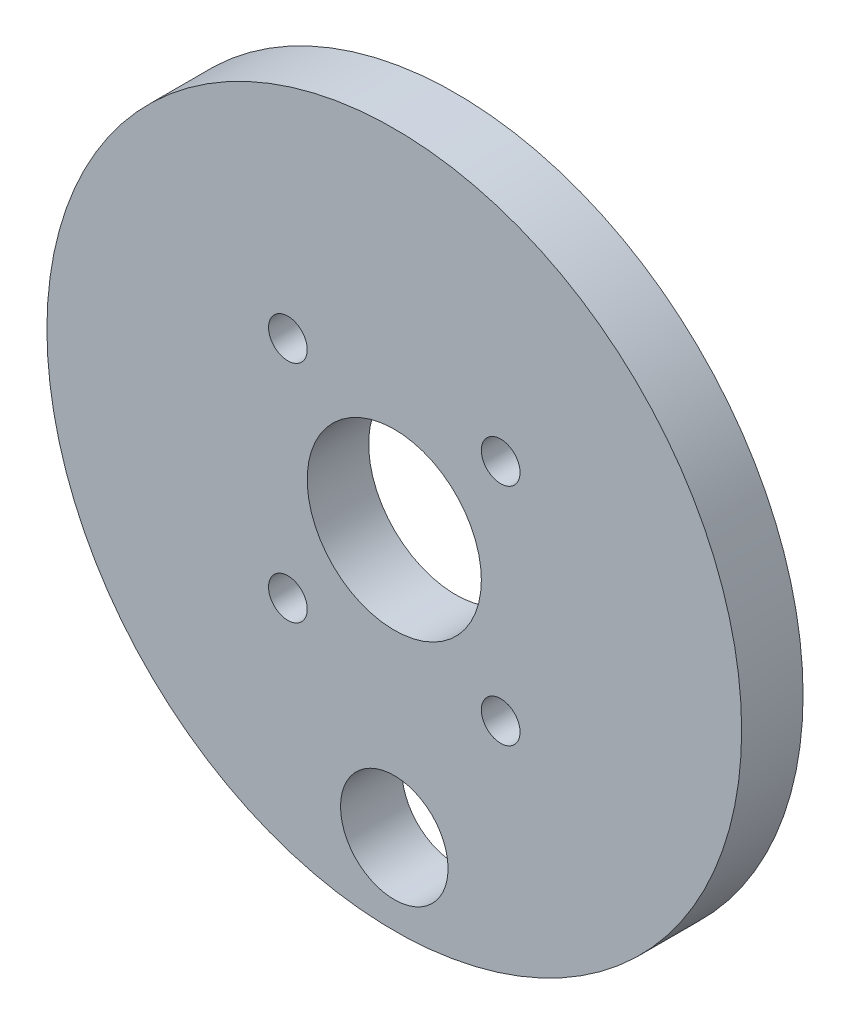
from build123d import *

# Parameters (mm, degrees)
SKETCH1_R           = 35.91
SKETCH1_R_2         = 9
BOSS_EXTRUDE1_DEPTH = 6.35
SKETCH2_R           = 2
CUT_EXTRUDE1_DEPTH  = 52.179866158
SKETCH3_R           = 5.55625
CUT_EXTRUDE2_DEPTH  = 52.179866158


with BuildPart() as part:
    # Sketch1 → Boss-Extrude1 (new body)
    with BuildSketch(Plane.XY):
        Circle(SKETCH1_R)
        Circle(SKETCH1_R_2, mode=Mode.SUBTRACT)
    extrude(amount=BOSS_EXTRUDE1_DEPTH)

    # Sketch2 → Cut-Extrude1 (cut, through all)
    with BuildSketch(Plane(origin=(0, 0, 0), x_dir=(-1, 0, 0), z_dir=(0, 0, -1))):
        with Locations((-11, 11.618950039)):
            Circle(SKETCH2_R)
        with Locations((11, 11.618950039)):
            Circle(SKETCH2_R)
        with Locations((11, -11.618950039)):
            Circle(SKETCH2_R)
        with Locations((-11, -11.618950039)):
            Circle(SKETCH2_R)
    extrude(amount=-CUT_EXTRUDE1_DEPTH, mode=Mode.SUBTRACT)

    # Sketch3 → Cut-Extrude2 (cut, through all)
    with BuildSketch(Plane(origin=(0, 0, 0), x_dir=(-1, 0, 0), z_dir=(0, 0, -1))):
        with Locations((0, -27.559440888)):
            Circle(SKETCH3_R)
    extrude(amount=-CUT_EXTRUDE2_DEPTH, mode=Mode.SUBTRACT)


solid = part.part
